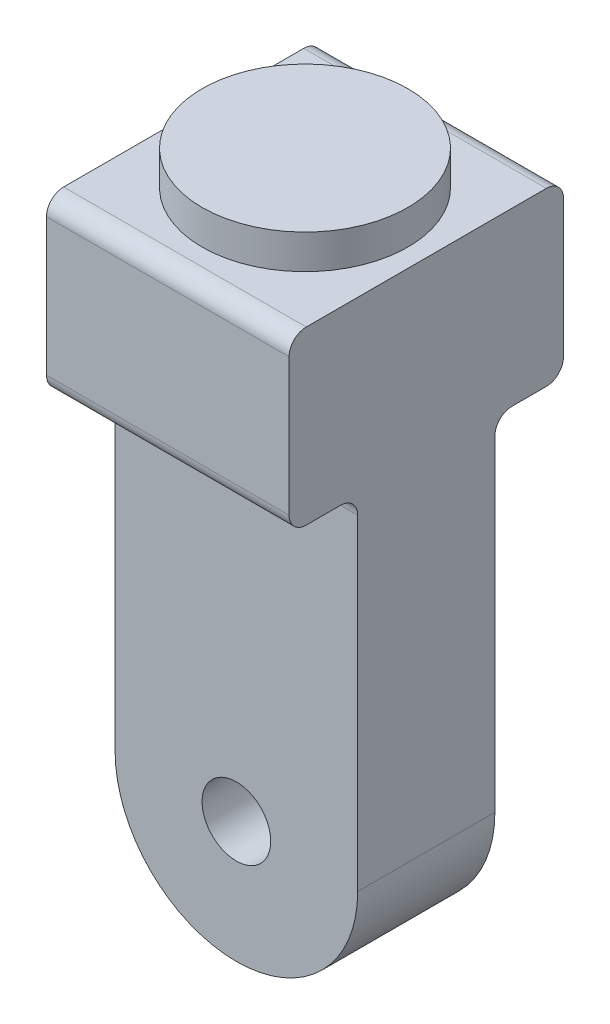
from build123d import *

# Parameters (mm, degrees)
BOSS_EXTRUDE1_DEPTH      = 40
BOSS_EXTRUDE1_DEPTH_BACK = 40
SKETCH1_R                = 10
CUT_EXTRUDE1_START       = -20
CUT_EXTRUDE1_DEPTH       = 20
CUT_EXTRUDE2_START       = -20
CUT_EXTRUDE2_DEPTH       = 20
SKETCH6_R                = 30
BOSS_EXTRUDE2_DEPTH      = 10
FILLET2_R                = 5
SHELL1_START             = -15
SHELL1_OUTLINE_R         = 15
SHELL1_DEPTH             = 30
SHELL1_START_2           = -35
SHELL1_2_OUTLINE_W       = 60.710678118
SHELL1_2_OUTLINE_H       = 40
SHELL1_2_DEPTH           = 70
SHELL1_START_3           = 715
SHELL1_3_OUTLINE_R       = 25
SHELL1_3_DEPTH           = 10
SHELL1_START_4           = -30.355339059
SHELL1_4_DEPTH           = 60.710678118


with BuildPart() as part:
    # Sketch1 → Boss-Extrude1 (new, two sides: drawn at the far end of the back side and taken through both)
    with BuildSketch(Plane.XY.offset(-BOSS_EXTRUDE1_DEPTH_BACK)):
        with BuildLine():
            Line((-35.355339059, 570), (-35.355339059, 720))
            Line((-35.355339059, 720), (35.355339059, 720))
            Line((35.355339059, 720), (35.355339059, 570))
            ThreePointArc((35.355339059, 570), (0, 534.644660941), (-35.355339059, 570))
        make_face()
        with Locations(Location((0, 570, 0), (0, 0, 180))):
            Circle(SKETCH1_R, mode=Mode.SUBTRACT)
    extrude(amount=BOSS_EXTRUDE1_DEPTH + BOSS_EXTRUDE1_DEPTH_BACK)

    # Sketch2 → Cut-Extrude1 (cut)
    with BuildSketch(Plane.XY.offset(40).offset(CUT_EXTRUDE1_START)):
        with BuildLine():
            Line((-35.355339059, 570), (-35.355339059, 670))
            Line((-35.355339059, 670), (35.355339059, 670))
            Line((35.355339059, 670), (35.355339059, 570))
            ThreePointArc((35.355339059, 570), (0, 534.644660941), (-35.355339059, 570))
        make_face()
    extrude(amount=CUT_EXTRUDE1_DEPTH, mode=Mode.SUBTRACT)

    # Sketch3 → Cut-Extrude2 (cut)
    with BuildSketch(Plane(origin=(0, 0, -40), x_dir=(-1, 0, 0), z_dir=(0, 0, -1)).offset(CUT_EXTRUDE2_START)):
        with BuildLine():
            Line((-35.355339059, 570), (-35.355339059, 670))
            Line((-35.355339059, 670), (35.355339059, 670))
            Line((35.355339059, 670), (35.355339059, 570))
            ThreePointArc((35.355339059, 570), (0, 534.644660941), (-35.355339059, 570))
        make_face()
    extrude(amount=CUT_EXTRUDE2_DEPTH, mode=Mode.SUBTRACT)

    # Sketch6 → Boss-Extrude2 (add)
    with BuildSketch(Plane(origin=(0, 720, 0), x_dir=(1, 0, 0), z_dir=(0, 1, 0))):
        with Locations(Location((0, 0, 0), (0, 0, 270))):
            Circle(SKETCH6_R)
    extrude(amount=BOSS_EXTRUDE2_DEPTH)

    # Fillet2
    fillet2_edges = [part.edges().sort_by_distance(p)[0] for p in [
        (0, 720, -40),
        (0, 720, 40),
        (0, 670, 40),
        (0, 670, 20),
        (0, 670, -40),
        (0, 670, -20),
    ]]
    fillet(fillet2_edges, radius=FILLET2_R)

    # Shell1: read off the stored shape, not the designer's step
    # Shell1 outline → Shell1 (cut)
    with BuildSketch(Plane.XY.offset(SHELL1_START)):
        with BuildLine():
            ThreePointArc((-30.355339059, 570), (0, 539.644660941), (30.355339059, 570))
            Line((30.355339059, 570), (30.355339059, 715))
            Line((30.355339059, 715), (-30.355339059, 715))
            Line((-30.355339059, 715), (-30.355339059, 570))
        make_face()
        with Locations((0, 570)):
            Circle(SHELL1_OUTLINE_R, mode=Mode.SUBTRACT)
    extrude(amount=SHELL1_DEPTH, mode=Mode.SUBTRACT)

    # Shell1 2 outline → Shell1 2 (cut)
    with BuildSketch(Plane.XY.offset(SHELL1_START_2)):
        with Locations((0, 695)):
            Rectangle(SHELL1_2_OUTLINE_W, SHELL1_2_OUTLINE_H)
    extrude(amount=SHELL1_2_DEPTH, mode=Mode.SUBTRACT)

    # Shell1 3 outline → Shell1 3 (cut)
    with BuildSketch(Plane(origin=(0, 0, 0), x_dir=(1, 0, 0), z_dir=(0, 1, 0)).offset(SHELL1_START_3)):
        Circle(SHELL1_3_OUTLINE_R)
    extrude(amount=SHELL1_3_DEPTH, mode=Mode.SUBTRACT)

    # Shell1 4 outline → Shell1 4 (cut)
    with BuildSketch(Plane.YZ.offset(SHELL1_START_4)):
        with BuildLine():
            ThreePointArc((675, 25), (672.071067812, 17.928932188), (665, 15))
            Line((665, 15), (675, 15))
            Line((675, 15), (675, 25))
        make_face()
        with BuildLine():
            Line((675, -15), (665, -15))
            ThreePointArc((665, -15), (672.071067812, -17.928932188), (675, -25))
            Line((675, -25), (675, -15))
        make_face()
    extrude(amount=SHELL1_4_DEPTH, mode=Mode.SUBTRACT)


solid = part.part
